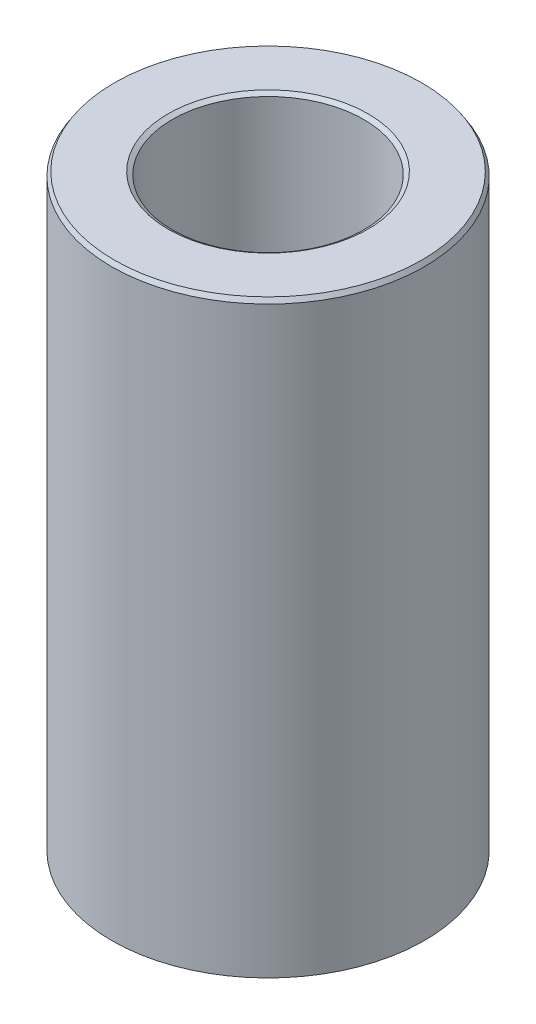
from build123d import *
from OCP.BRepFilletAPI import BRepFilletAPI_MakeChamfer

# Parameters (mm, degrees)
SKETCH1_R           = 37.5
BOSS_EXTRUDE1_DEPTH = 141.627916831
SKETCH2_R           = 22.943385862
CUT_EXTRUDE1_DEPTH  = 152.231500773
CHAMFER1_SIZE       = 1.032311707
CHAMFER1_SIZE2      = 0.659392673


with BuildPart() as part:
    # Sketch1 → Boss-Extrude1 (new body)
    with BuildSketch(Plane(origin=(0, 0, 0), x_dir=(1, 0, 0), z_dir=(0, 1, 0))):
        Circle(SKETCH1_R)
    extrude(amount=BOSS_EXTRUDE1_DEPTH)

    # Sketch2 → Cut-Extrude1 (cut, through all)
    with BuildSketch(Plane(origin=(0, 0, 0), x_dir=(1, 0, 0), z_dir=(0, 1, 0))):
        Circle(SKETCH2_R)
    extrude(amount=CUT_EXTRUDE1_DEPTH, mode=Mode.SUBTRACT)

    # Chamfer1: one chamfer whose edges measure the first distance from different faces: ONE call of the kernel's chamfer builder (chamfer() names one face for all edges)
    chamfer1_edges_1 = [part.edges().sort_by_distance(p)[0] for p in [
        (-22.943385862, 141.627916831, 0),
    ]]
    chamfer1_side_1 = [part.faces().sort_by_distance(p)[0] for p in [
        (-36.439339828, 141.627916831, 0),
    ]]
    chamfer1_edges_2 = [part.edges().sort_by_distance(p)[0] for p in [
        (-22.943385862, 0, 0),
    ]]
    chamfer1_side_2 = [part.faces().sort_by_distance(p)[0] for p in [
        (-22.943385862, 70.813958416, 0),
    ]]
    chamfer1_edges_3 = [part.edges().sort_by_distance(p)[0] for p in [
        (-37.5, 0, 0),
    ]]
    chamfer1_side_3 = [part.faces().sort_by_distance(p)[0] for p in [
        (-36.439339828, 0, 0),
    ]]
    chamfer1_edges_4 = [part.edges().sort_by_distance(p)[0] for p in [
        (-37.5, 141.627916831, 0),
    ]]
    chamfer1_side_4 = [part.faces().sort_by_distance(p)[0] for p in [
        (-37.5, 70.813958416, 0),
    ]]
    chamfer1 = BRepFilletAPI_MakeChamfer(part.part.solid().wrapped)
    for e in chamfer1_edges_1:
        chamfer1.Add(CHAMFER1_SIZE, CHAMFER1_SIZE2, e.wrapped, chamfer1_side_1[0].wrapped)  # the first distance lies on this face
    for e in chamfer1_edges_2:
        chamfer1.Add(CHAMFER1_SIZE, CHAMFER1_SIZE2, e.wrapped, chamfer1_side_2[0].wrapped)  # the first distance lies on this face
    for e in chamfer1_edges_3:
        chamfer1.Add(CHAMFER1_SIZE, CHAMFER1_SIZE2, e.wrapped, chamfer1_side_3[0].wrapped)  # the first distance lies on this face
    for e in chamfer1_edges_4:
        chamfer1.Add(CHAMFER1_SIZE, CHAMFER1_SIZE2, e.wrapped, chamfer1_side_4[0].wrapped)  # the first distance lies on this face
    add(Compound.cast(chamfer1.Shape()), mode=Mode.REPLACE)


solid = part.part
